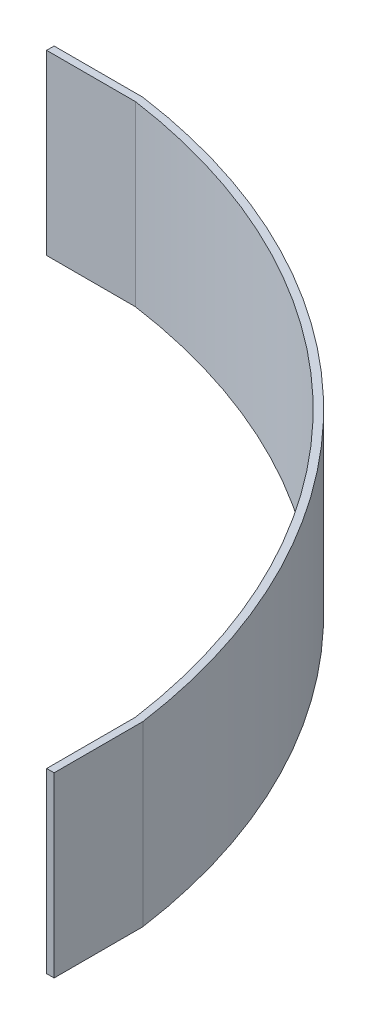
from build123d import *

# Parameters (mm, degrees)
BOSS_EXTRUDE1_DEPTH = 38.1


with BuildPart() as part:
    # Sketch1 → Boss-Extrude1 (new body)
    with BuildSketch(Plane(origin=(0, 0, 0), x_dir=(1, 0, 0), z_dir=(0, 1, 0))):
        with BuildLine():
            Line((0, 134.953426611), (0, 133.35))
            Line((0, 133.35), (19.05, 133.35))
            ThreePointArc((19.05, 133.35), (95.25, 95.25), (133.35, 19.05))
            Line((133.35, 19.05), (133.35, 0))
            Line((133.35, 0), (134.953426611, 0))
            Line((134.953426611, 0), (134.953426611, 19.05))
            ThreePointArc((134.953426611, 19.05), (96.372532015, 96.372532015), (19.05, 134.953426611))
            Line((19.05, 134.953426611), (0, 134.953426611))
        make_face()
    extrude(amount=BOSS_EXTRUDE1_DEPTH)


solid = part.part
